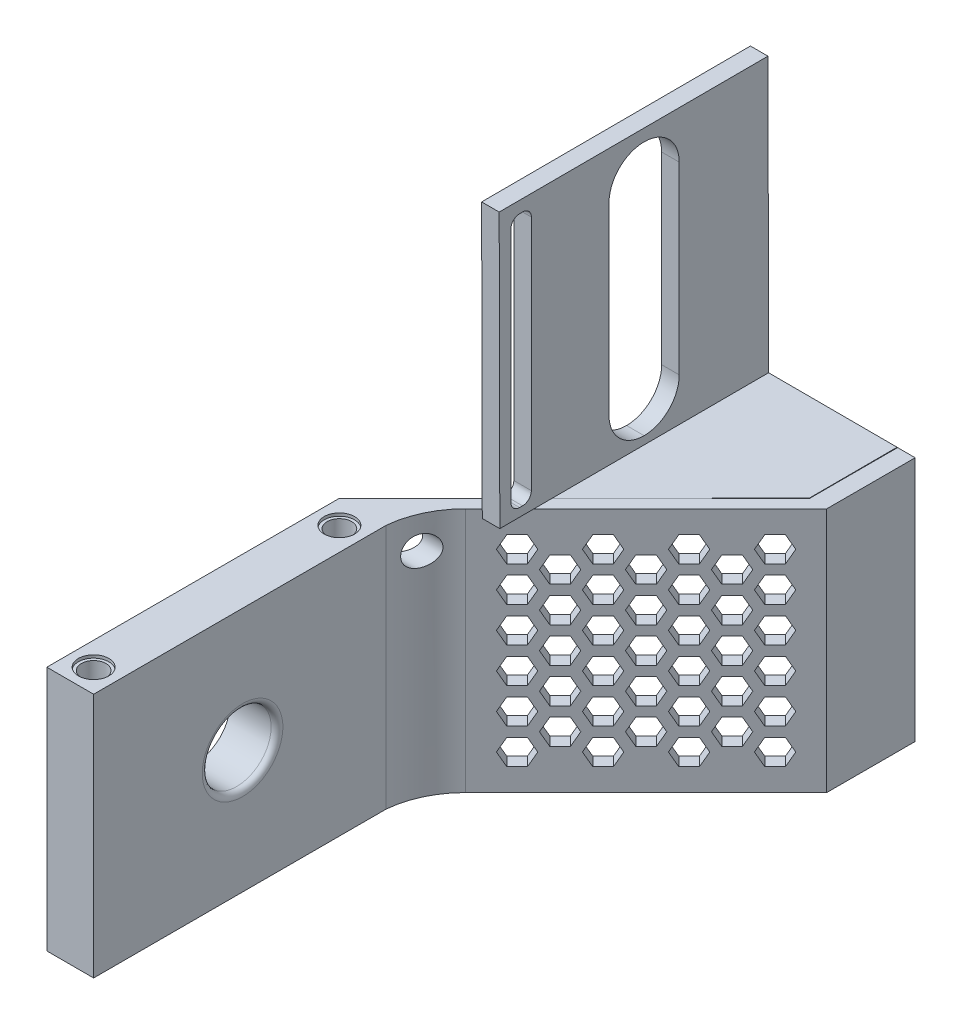
from build123d import *

# Parameters (mm, degrees)
SKETCH1_W           = 25
SKETCH1_H           = 50
SKETCH1_R           = 3.4
BOSS_EXTRUDE1_DEPTH = 3
SKETCH2_W           = 50
SKETCH2_H           = 3
BOSS_EXTRUDE2_DEPTH = 8
SKETCH3_W           = 8
SKETCH3_H           = 50
BOSS_EXTRUDE3_DEPTH = 42
SKETCH4_R           = 2.65
CUT_EXTRUDE1_DEPTH  = 0.5
SKETCH5_R           = 5.888972746
CUT_EXTRUDE2_DEPTH  = 9
FILLET2_R           = 1
SKETCH6_R           = 12.6
BOSS_EXTRUDE4_DEPTH = 2
FILLET4_R           = 1
SKETCH8_R           = 1.589780168
SKETCH8_R_2         = 1.777428262
CUT_EXTRUDE3_DEPTH  = 10
SKETCH9_W           = 49.021678163
SKETCH9_H           = 20.976854622
CUT_EXTRUDE4_DEPTH  = 68.79439129
SKETCH11_R          = 2.1
CUT_EXTRUDE5_DEPTH  = 59.480168703
SKETCH14_R          = 2.6
CUT_EXTRUDE6_DEPTH  = 0.5
BOSS_EXTRUDE5_DEPTH = 42
FILLET5_R           = 15
BOSS_EXTRUDE6_DEPTH = 42
SKETCH17_W          = 45.935216198
SKETCH17_H          = 46.909785601
BOSS_EXTRUDE7_DEPTH = 3
BOSS_EXTRUDE8_DEPTH = 1
FILL_START          = -38.613550417
FILL_PATTERN1_DEPTH = 2.200895832
SKETCH20_W          = 3.5
SKETCH20_H          = 43.48627111
CUT_EXTRUDE7_DEPTH  = 10
FILLET6_R           = 1.5
SKETCH21_W          = 12
SKETCH21_H          = 43.48627111
CUT_EXTRUDE8_DEPTH  = 10
FILLET7_R           = 6
SKETCH22_R          = 2.5
CUT_EXTRUDE9_DEPTH  = 19


# Read off the part's stored shape, not the designer's step: Fill Pattern1
# Some blends are built 0.0001 mm under size
with BuildPart() as part:
    # Sketch1 → Boss-Extrude1 (new body)
    with BuildSketch(Plane(origin=(0, 0, 0), x_dir=(1, 0, 0), z_dir=(0, 1, 0))):
        with Locations((2.276951673, 11.384758364)):
            Rectangle(SKETCH1_W, SKETCH1_H)
        with Locations(Location((1.276951673, 11.384758364, 0), (0, 0, 270))):
            Circle(SKETCH1_R, mode=Mode.SUBTRACT)
    extrude(amount=BOSS_EXTRUDE1_DEPTH)

    # Sketch2 → Boss-Extrude2 (add)
    with BuildSketch(Plane.ZY.offset(10.223048327)):
        with Locations((-11.384758364, 1.5)):
            Rectangle(SKETCH2_W, SKETCH2_H)
    extrude(amount=BOSS_EXTRUDE2_DEPTH)

    # Sketch3 → Boss-Extrude3 (add)
    with BuildSketch(Plane.XZ):
        with Locations((-14.223048327, -11.384758364)):
            Rectangle(SKETCH3_W, SKETCH3_H)
    extrude(amount=BOSS_EXTRUDE3_DEPTH)

    # Sketch4 → Cut-Extrude1 (cut)
    with BuildSketch(Plane(origin=(0, 3, 0), x_dir=(1, 0, 0), z_dir=(0, 1, 0))):
        with Locations(Location((-14.223048327, 32.384758364, 0), (0, 0, 270))):
            Circle(SKETCH4_R)
        with Locations(Location((-14.223048327, -9.615241636, 0), (0, 0, 270))):
            Circle(SKETCH4_R)
    cut_extrude1 = extrude(amount=-CUT_EXTRUDE1_DEPTH, mode=Mode.SUBTRACT)

    # Mirror1: Cut-Extrude1 across plane
    add(cut_extrude1.mirror(Plane.ZX.offset(-19.5)), mode=Mode.SUBTRACT)

    # Sketch5 → Cut-Extrude2 (cut)
    with BuildSketch(Plane.ZY.offset(18.223048327)):
        with Locations((-11.836279124, -21)):
            Circle(SKETCH5_R)
    extrude(amount=-CUT_EXTRUDE2_DEPTH, mode=Mode.SUBTRACT)

    # Fillet2
    fillet2_edges = [part.edges().sort_by_distance(p)[0] for p in [
        (-10.223048327, -21, -17.72525187),
    ]]
    fillet(fillet2_edges, radius=FILLET2_R)

    # Mirror2: Cut-Extrude1 across plane
    add(cut_extrude1.mirror(Plane.ZY.offset(1.723048327)), mode=Mode.SUBTRACT)

    # Sketch6 → Boss-Extrude4 (add)
    with BuildSketch(Plane(origin=(0, 3, 0), x_dir=(1, 0, 0), z_dir=(0, 1, 0))):
        with BuildLine():
            Line((14.776951673, 5.825082115), (14.776951673, 16.944434614))
            ThreePointArc((14.776951673, 16.944434614), (-13.323048327, 11.384758364), (14.776951673, 5.825082115))
        make_face()
        with Locations(Location((1.276951673, 11.384758364, 0), (0, 0, 270))):
            Circle(SKETCH6_R, mode=Mode.SUBTRACT)
    extrude(amount=BOSS_EXTRUDE4_DEPTH)

    # Fillet4
    # the kernel refuses this fillet: 1 mm, written as the material it takes off along each edge
    with BuildSketch(Plane(origin=(14.776951673, 5, -3.325082115), x_dir=(0, -1, 0), z_dir=(0, 0, -1))) as fillet4_piece_1:
        with BuildLine():
            CenterArc((FILLET4_R, FILLET4_R), FILLET4_R, 180, 90)
            Line((0, FILLET4_R), (0, 0))
            Line((0, 0), (FILLET4_R, 0))
        make_face()
    extrude(amount=16.119352499, mode=Mode.SUBTRACT)

    # Sketch8 → Cut-Extrude3 (cut)
    with BuildSketch(Plane(origin=(0, 3, 0), x_dir=(1, 0, 0), z_dir=(0, 1, 0))):
        with Locations(Location((1.276951673, 19.884758364, 0), (0, 0, 270))):
            Circle(SKETCH8_R)
        with Locations(Location((1.276951673, 2.884758364, 0), (0, 0, 270))):
            Circle(SKETCH8_R_2)
    extrude(amount=-CUT_EXTRUDE3_DEPTH, mode=Mode.SUBTRACT)

    # Sketch9 → Cut-Extrude4 (cut, through all)
    with BuildSketch(Plane.XY.offset(13.615241636)):
        with Locations((-9.733887409, 10.488427311)):
            Rectangle(SKETCH9_W, SKETCH9_H)
    extrude(amount=-CUT_EXTRUDE4_DEPTH, mode=Mode.SUBTRACT)

    # Sketch11 → Cut-Extrude5 (cut, through all)
    with BuildSketch(Plane(origin=(0, 0, 0), x_dir=(1, 0, 0), z_dir=(0, 1, 0))):
        with Locations(Location((-14.223048327, 32.384758364, 0), (0, 0, 270))):
            Circle(SKETCH11_R)
    cut_extrude5 = extrude(amount=-CUT_EXTRUDE5_DEPTH, mode=Mode.SUBTRACT)

    # Mirror3: Cut-Extrude5 across plane
    add(cut_extrude5.mirror(Plane.XY.offset(-11.384758364)), mode=Mode.SUBTRACT)

    # Sketch14 → Cut-Extrude6 (cut)
    with BuildSketch(Plane(origin=(0, 0, 0), x_dir=(1, 0, 0), z_dir=(0, 1, 0))):
        with Locations(Location((-14.223048327, -9.615241636, 0), (0, 0, 270))):
            Circle(SKETCH14_R)
    cut_extrude6 = extrude(amount=-CUT_EXTRUDE6_DEPTH, mode=Mode.SUBTRACT)

    # Mirror4: Cut-Extrude6 across plane
    add(cut_extrude6.mirror(Plane.XY.offset(-11.384758364)), mode=Mode.SUBTRACT)

    # Sketch15 → Boss-Extrude5 (add)
    with BuildSketch(Plane(origin=(0, 0, 0), x_dir=(1, 0, 0), z_dir=(0, 1, 0))):
        Polygon((-18.223048327, 36.384758364), (24.976951673, 79.584758364), (24.976951673, 76.472221629), (-15.110511592, 36.384758364), align=None)
    extrude(amount=-BOSS_EXTRUDE5_DEPTH)

    # Fillet5
    # the kernel refuses this fillet: 15 mm, written as the material it adds along each edge
    with BuildSketch(Plane(origin=(-15.110511592, 0, -36.384758364), x_dir=(1, 0, 0), z_dir=(0, -1, 0))) as fillet5_piece_1:
        with BuildLine():
            CenterArc((19.822892097, 1.390311339), FILLET5_R, 185.31823153, 39.68176847)
            Line((9.216290379, -9.216290379), (0, 0))
            Line((0, 0), (4.887463265, 0))
        make_face()
    extrude(amount=42)

    # Sketch16 → Boss-Extrude6 (add)
    with BuildSketch(Plane(origin=(0, 0, 0), x_dir=(1, 0, 0), z_dir=(0, 1, 0))):
        Polygon((21.976951673, 76.584758364), (21.976951673, 91.584758364), (24.976951673, 91.584758364), (24.976951673, 79.584758364), align=None)
    extrude(amount=-BOSS_EXTRUDE6_DEPTH)



with BuildPart() as body_2:
    # Sketch17 → Boss-Extrude7 (new body)
    with BuildSketch(Plane(origin=(-0.023048327, -88.270826713, 236.630045038), x_dir=(0, 0.002303401717977271, -0.999997347166744), z_dir=(1, 0, 0))):
        with Locations((305.401276342, 111.07539376)):
            Rectangle(SKETCH17_W, SKETCH17_H)
    extrude(amount=-BOSS_EXTRUDE7_DEPTH)


with BuildPart() as part_1:
    add(part.part)

    add(body_2.part)  # Boss-Extrude8 merges body 2
    # Sketch18 → Boss-Extrude8 (add)
    with BuildSketch(Plane(origin=(0, -0.105037255, -0.000241944), x_dir=(1, 0, 0), z_dir=(0, -0.9999973471667442, -0.0023034017179773937))):
        Polygon((21.976951673, -91.487772533), (-3.023048327, -91.536143969), (-3.023048327, -51.487878646), (21.976951673, -76.487812326), align=None)
    extrude(amount=BOSS_EXTRUDE8_DEPTH)

    # Fill Pattern1 outline → Fill Pattern1 (cut)
    with BuildSketch(Plane(origin=(0, 0, 0), x_dir=(0.7071067811865457, 0, -0.7071067811865495), z_dir=(0.7071067811865493, 0, 0.7071067811865458)).offset(FILL_START)):
        Polygon((31.817725429, -6), (33.067725429, -8.165063509), (35.567725429, -8.165063509), (36.817725429, -6), (35.567725429, -3.834936491), (33.067725429, -3.834936491), align=None)
        Polygon((47.406182697, -33), (48.656182697, -35.165063509), (51.156182697, -35.165063509), (52.406182697, -33), (51.156182697, -30.834936491), (48.656182697, -30.834936491), align=None)
        Polygon((42.210030274, -24), (43.460030274, -26.165063509), (45.960030274, -26.165063509), (47.210030274, -24), (45.960030274, -21.834936491), (43.460030274, -21.834936491), align=None)
        Polygon((37.013877851, -15), (38.263877851, -17.165063509), (40.763877851, -17.165063509), (42.013877851, -15), (40.763877851, -12.834936491), (38.263877851, -12.834936491), align=None)
        Polygon((53.852335119, -8.165063509), (56.352335119, -8.165063509), (57.602335119, -6), (56.352335119, -3.834936491), (53.852335119, -3.834936491), (52.602335119, -6), align=None)
        Polygon((43.460030274, -8.165063509), (45.960030274, -8.165063509), (47.210030274, -6), (45.960030274, -3.834936491), (43.460030274, -3.834936491), (42.210030274, -6), align=None)
        Polygon((64.244639965, -8.165063509), (66.744639965, -8.165063509), (67.994639965, -6), (66.744639965, -3.834936491), (64.244639965, -3.834936491), (62.994639965, -6), align=None)
        Polygon((31.817725429, -24), (33.067725429, -26.165063509), (35.567725429, -26.165063509), (36.817725429, -24), (35.567725429, -21.834936491), (33.067725429, -21.834936491), align=None)
        Polygon((37.013877851, -33), (38.263877851, -35.165063509), (40.763877851, -35.165063509), (42.013877851, -33), (40.763877851, -30.834936491), (38.263877851, -30.834936491), align=None)
        Polygon((64.244639965, -26.165063509), (66.744639965, -26.165063509), (67.994639965, -24), (66.744639965, -21.834936491), (64.244639965, -21.834936491), (62.994639965, -24), align=None)
        Polygon((53.852335119, -26.165063509), (56.352335119, -26.165063509), (57.602335119, -24), (56.352335119, -21.834936491), (53.852335119, -21.834936491), (52.602335119, -24), align=None)
        Polygon((59.048487542, -35.165063509), (61.548487542, -35.165063509), (62.798487542, -33), (61.548487542, -30.834936491), (59.048487542, -30.834936491), (57.798487542, -33), align=None)
        Polygon((51.156182697, -17.165063509), (52.406182697, -15), (51.156182697, -12.834936491), (48.656182697, -12.834936491), (47.406182697, -15), (48.656182697, -17.165063509), align=None)
        Polygon((37.013877851, -27), (38.263877851, -29.165063509), (40.763877851, -29.165063509), (42.013877851, -27), (40.763877851, -24.834936491), (38.263877851, -24.834936491), align=None)
        Polygon((31.817725429, -18), (33.067725429, -20.165063509), (35.567725429, -20.165063509), (36.817725429, -18), (35.567725429, -15.834936491), (33.067725429, -15.834936491), align=None)
        Polygon((42.210030274, -36), (43.460030274, -38.165063509), (45.960030274, -38.165063509), (47.210030274, -36), (45.960030274, -33.834936491), (43.460030274, -33.834936491), align=None)
        Polygon((59.048487542, -29.165063509), (61.548487542, -29.165063509), (62.798487542, -27), (61.548487542, -24.834936491), (59.048487542, -24.834936491), (57.798487542, -27), align=None)
        Polygon((48.656182697, -29.165063509), (51.156182697, -29.165063509), (52.406182697, -27), (51.156182697, -24.834936491), (48.656182697, -24.834936491), (47.406182697, -27), align=None)
        Polygon((35.567725429, -38.165063509), (36.817725429, -36), (35.567725429, -33.834936491), (33.067725429, -33.834936491), (31.817725429, -36), (33.067725429, -38.165063509), align=None)
        Polygon((51.156182697, -11.165063509), (52.406182697, -9), (51.156182697, -6.834936491), (48.656182697, -6.834936491), (47.406182697, -9), (48.656182697, -11.165063509), align=None)
        Polygon((45.960030274, -20.165063509), (47.210030274, -18), (45.960030274, -15.834936491), (43.460030274, -15.834936491), (42.210030274, -18), (43.460030274, -20.165063509), align=None)
        Polygon((37.013877851, -21), (38.263877851, -23.165063509), (40.763877851, -23.165063509), (42.013877851, -21), (40.763877851, -18.834936491), (38.263877851, -18.834936491), align=None)
        Polygon((31.817725429, -12), (33.067725429, -14.165063509), (35.567725429, -14.165063509), (36.817725429, -12), (35.567725429, -9.834936491), (33.067725429, -9.834936491), align=None)
        Polygon((42.210030274, -30), (43.460030274, -32.165063509), (45.960030274, -32.165063509), (47.210030274, -30), (45.960030274, -27.834936491), (43.460030274, -27.834936491), align=None)
        Polygon((59.048487542, -23.165063509), (61.548487542, -23.165063509), (62.798487542, -21), (61.548487542, -18.834936491), (59.048487542, -18.834936491), (57.798487542, -21), align=None)
        Polygon((48.656182697, -23.165063509), (51.156182697, -23.165063509), (52.406182697, -21), (51.156182697, -18.834936491), (48.656182697, -18.834936491), (47.406182697, -21), align=None)
        Polygon((35.567725429, -32.165063509), (36.817725429, -30), (35.567725429, -27.834936491), (33.067725429, -27.834936491), (31.817725429, -30), (33.067725429, -32.165063509), align=None)
        Polygon((45.960030274, -14.165063509), (47.210030274, -12), (45.960030274, -9.834936491), (43.460030274, -9.834936491), (42.210030274, -12), (43.460030274, -14.165063509), align=None)
        Polygon((64.244639965, -32.165063509), (66.744639965, -32.165063509), (67.994639965, -30), (66.744639965, -27.834936491), (64.244639965, -27.834936491), (62.994639965, -30), align=None)
        Polygon((53.852335119, -32.165063509), (56.352335119, -32.165063509), (57.602335119, -30), (56.352335119, -27.834936491), (53.852335119, -27.834936491), (52.602335119, -30), align=None)
        Polygon((64.244639965, -38.165063509), (66.744639965, -38.165063509), (67.994639965, -36), (66.744639965, -33.834936491), (64.244639965, -33.834936491), (62.994639965, -36), align=None)
        Polygon((53.852335119, -38.165063509), (56.352335119, -38.165063509), (57.602335119, -36), (56.352335119, -33.834936491), (53.852335119, -33.834936491), (52.602335119, -36), align=None)
        Polygon((57.798487542, -15), (59.048487542, -17.165063509), (61.548487542, -17.165063509), (62.798487542, -15), (61.548487542, -12.834936491), (59.048487542, -12.834936491), align=None)
        Polygon((57.798487542, -9), (59.048487542, -11.165063509), (61.548487542, -11.165063509), (62.798487542, -9), (61.548487542, -6.834936491), (59.048487542, -6.834936491), align=None)
        Polygon((62.994639965, -18), (64.244639965, -20.165063509), (66.744639965, -20.165063509), (67.994639965, -18), (66.744639965, -15.834936491), (64.244639965, -15.834936491), align=None)
        Polygon((38.263877851, -11.165063509), (40.763877851, -11.165063509), (42.013877851, -9), (40.763877851, -6.834936491), (38.263877851, -6.834936491), (37.013877851, -9), align=None)
        Polygon((56.352335119, -20.165063509), (57.602335119, -18), (56.352335119, -15.834936491), (53.852335119, -15.834936491), (52.602335119, -18), (53.852335119, -20.165063509), align=None)
        Polygon((64.244639965, -14.165063509), (66.744639965, -14.165063509), (67.994639965, -12), (66.744639965, -9.834936491), (64.244639965, -9.834936491), (62.994639965, -12), align=None)
        Polygon((53.852335119, -14.165063509), (56.352335119, -14.165063509), (57.602335119, -12), (56.352335119, -9.834936491), (53.852335119, -9.834936491), (52.602335119, -12), align=None)
    extrude(amount=FILL_PATTERN1_DEPTH, mode=Mode.SUBTRACT)

    # Sketch20 → Cut-Extrude7 (cut)
    with BuildSketch(Plane(origin=(-0.023048327, 0, 0), x_dir=(0, 0, -1), z_dir=(1, 0, 0))):
        with Locations((49.241338831, 23.171442648)):
            Rectangle(SKETCH20_W, SKETCH20_H)
    extrude(amount=-CUT_EXTRUDE7_DEPTH, mode=Mode.SUBTRACT)

    # Fillet6
    fillet6_edges = [part_1.edges().sort_by_distance(p)[0] for p in [
        (-1.523048327, 1.428307093, -47.491338831),
        (-1.523048327, 44.914578203, -47.491338831),
        (-1.523048327, 44.914578203, -50.991338831),
        (-1.523048327, 1.428307093, -50.991338831),
    ]]
    fillet(fillet6_edges, radius=FILLET6_R)

    # Sketch21 → Cut-Extrude8 (cut)
    with BuildSketch(Plane(origin=(-0.023048327, 0, 0), x_dir=(0, 0, -1), z_dir=(1, 0, 0))):
        with Locations((70.260862036, 23.171442648)):
            Rectangle(SKETCH21_W, SKETCH21_H)
    extrude(amount=-CUT_EXTRUDE8_DEPTH, mode=Mode.SUBTRACT)

    # Fillet7
    fillet7_edges = [part_1.edges().sort_by_distance(p)[0] for p in [
        (-1.523048327, 1.428307093, -76.260862036),
        (-1.523048327, 1.428307093, -64.260862036),
        (-1.523048327, 44.914578203, -64.260862036),
        (-1.523048327, 44.914578203, -76.260862036),
    ]]
    fillet(fillet7_edges, radius=FILLET7_R - 0.0001)  # a hair under: the kernel refuses the full size

    # Sketch22 → Cut-Extrude9 (cut)
    with BuildSketch(Plane(origin=(-0.023048327, -88.270826713, 236.630045038), x_dir=(0, 0.002303401717977271, -0.999997347166744), z_dir=(1, 0, 0))):
        with Locations(Location((277.825361125, 82.131101179, 0), (0, 0, 89.868024686))):
            Circle(SKETCH22_R)
    extrude(amount=-CUT_EXTRUDE9_DEPTH, mode=Mode.SUBTRACT)


solid = part_1.part
